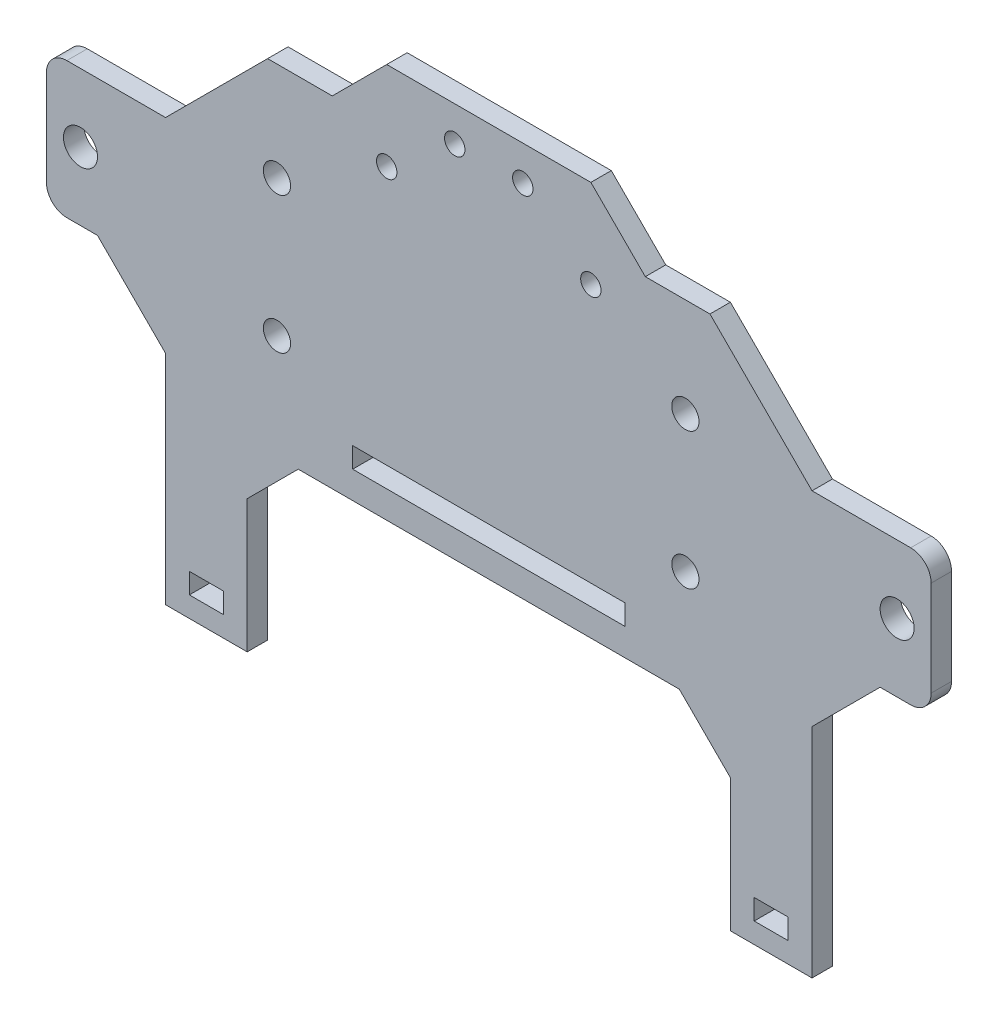
from build123d import *

# Parameters (mm, degrees)
SKETCH1_R           = 1.5
SKETCH1_R_2         = 2.5
BOSS_EXTRUDE1_DEPTH = 3
CUT_EXTRUDE1_DEPTH  = 3
FILLET1_R           = 3
CHAMFER4_SIZE       = 15
CHAMFER5_SIZE       = 10
SKETCH13_W          = 30
SKETCH13_H          = 8
BOSS_EXTRUDE5_DEPTH = 3
SKETCH8_W           = 95
SKETCH8_H           = 65.304735008
CUT_EXTRUDE5_DEPTH  = 10
SKETCH11_W          = 95
SKETCH11_H          = 7
BOSS_EXTRUDE3_DEPTH = 3
SKETCH10_R          = 1.5
CUT_EXTRUDE6_DEPTH  = 3
BOSS_EXTRUDE4_DEPTH = 3
CHAMFER6_SIZE       = 8
SKETCH17_R          = 2
CUT_EXTRUDE9_DEPTH  = 10
SKETCH15_W          = 40
SKETCH15_H          = 3
CUT_EXTRUDE8_DEPTH  = 10
BOSS_EXTRUDE6_START = -3
BOSS_EXTRUDE6_DEPTH = 3
SKETCH18_W          = 5
SKETCH18_H          = 3
CUT_EXTRUDE11_DEPTH = 10


with BuildPart() as part:
    # Sketch1 → Boss-Extrude1 (new body)
    with BuildSketch(Plane.XY):
        with BuildLine():
            Line((40.5, -40), (44.5, -40))
            Line((44.5, -40), (47.5, -37))
            Line((47.5, -37), (47.5, 10))
            Line((47.5, 10), (47.5, 15))
            Line((47.5, 15), (52.5, 15))
            Line((52.5, 15), (70, 15))
            ThreePointArc((70, 15), (73.535533906, 16.464466094), (75, 20))
            Line((75, 20), (75, 60))
            ThreePointArc((75, 60), (73.535533906, 63.535533906), (70, 65))
            Line((70, 65), (-70, 65))
            ThreePointArc((-70, 65), (-73.535533906, 63.535533906), (-75, 60))
            Line((-75, 60), (-75, 20))
            ThreePointArc((-75, 20), (-73.535533906, 16.464466094), (-70, 15))
            Line((-70, 15), (-52.5, 15))
            Line((-52.5, 15), (-47.5, 15))
            Line((-47.5, 15), (-47.5, 10))
            Line((-47.5, 10), (-47.5, -37))
            Line((-47.5, -37), (-44.5, -40))
            Line((-44.5, -40), (-40.5, -40))
            Line((-40.5, -40), (-37.5, -37))
            Line((-37.5, -37), (-37.5, 10))
            ThreePointArc((-37.5, 10), (-36.035533906, 13.535533906), (-32.5, 15))
            Line((-32.5, 15), (32.5, 15))
            ThreePointArc((32.5, 15), (36.035533906, 13.535533906), (37.5, 10))
            Line((37.5, 10), (37.5, -37))
            Line((37.5, -37), (40.5, -40))
        make_face()
        with Locations((-42.5, -20)):
            Circle(SKETCH1_R, mode=Mode.SUBTRACT)
        with Locations((-42.5, -35)):
            Circle(SKETCH1_R, mode=Mode.SUBTRACT)
        with Locations((42.5, -20)):
            Circle(SKETCH1_R, mode=Mode.SUBTRACT)
        with Locations((42.5, -35)):
            Circle(SKETCH1_R, mode=Mode.SUBTRACT)
        with Locations((60, 40)):
            Circle(SKETCH1_R_2, mode=Mode.SUBTRACT)
        with Locations((15, 60)):
            Circle(SKETCH1_R, mode=Mode.SUBTRACT)
        with Locations(Location((-15, 60, 0), (0, 0, 180))):
            Circle(SKETCH1_R, mode=Mode.SUBTRACT)
        with Locations(Location((-60, 40, 0), (0, 0, 180))):
            Circle(SKETCH1_R_2, mode=Mode.SUBTRACT)
    extrude(amount=BOSS_EXTRUDE1_DEPTH)

    # Sketch3 → Cut-Extrude1 (cut)
    with BuildSketch(Plane.XY.offset(3)):
        Polygon((65, 50), (65, 30), (47.5, 30), (47.5, 15), (75, 15), (75, 23.034767996), (75, 32.364095159), (75, 65), (47.5, 65), (47.5, 50), align=None)
        Polygon((-47.5, 65), (-75, 65), (-75, 32.364095159), (-75, 23.034767996), (-75, 15), (-47.5, 15), (-47.5, 30), (-65, 30), (-65, 50), (-47.5, 50), align=None)
    extrude(amount=-CUT_EXTRUDE1_DEPTH, mode=Mode.SUBTRACT)

    # Fillet1
    fillet1_edges = [part.edges().sort_by_distance(p)[0] for p in [
        (65, 50, 1.5),
        (65, 30, 1.5),
        (-65, 50, 1.5),
        (-65, 30, 1.5),
    ]]
    fillet(fillet1_edges, radius=FILLET1_R)

    # Chamfer4
    chamfer4_edges = [part.edges().sort_by_distance(p)[0] for p in [
        (47.5, 65, 1.5),
        (-47.5, 65, 1.5),
    ]]
    chamfer(chamfer4_edges, length=CHAMFER4_SIZE - 0.0001)  # a hair under: the kernel refuses the full size

    # Chamfer5
    chamfer5_edges = [part.edges().sort_by_distance(p)[0] for p in [
        (47.5, 30, 1.5),
        (-47.5, 30, 1.5),
    ]]
    chamfer(chamfer5_edges, length=CHAMFER5_SIZE)

    # Sketch13 → Boss-Extrude5 (add)
    with BuildSketch(Plane.XY.offset(3)):
        with Locations((0, 69)):
            Rectangle(SKETCH13_W, SKETCH13_H)
    extrude(amount=-BOSS_EXTRUDE5_DEPTH)

    # Sketch8 → Cut-Extrude5 (cut)
    with BuildSketch(Plane.XY.offset(3)):
        with Locations((0, -12.652367504)):
            Rectangle(SKETCH8_W, SKETCH8_H)
    extrude(amount=-CUT_EXTRUDE5_DEPTH, mode=Mode.SUBTRACT)

    # Sketch11 → Boss-Extrude3 (add)
    with BuildSketch(Plane.XY.offset(3)):
        with Locations((0, 16.5)):
            Rectangle(SKETCH11_W, SKETCH11_H)
    extrude(amount=-BOSS_EXTRUDE3_DEPTH)

    # Sketch10 → Cut-Extrude6 (cut)
    with BuildSketch(Plane.XY.offset(3)):
        with Locations((5, 67.89)):
            Circle(SKETCH10_R)
        with Locations(Location((-5, 67.89, 0), (0, 0, 180))):
            Circle(SKETCH10_R)
        with Locations((-5, 18.11)):
            Circle(SKETCH10_R)
        with Locations(Location((5, 18.11, 0), (0, 0, 180))):
            Circle(SKETCH10_R)
        Polygon((-30, 13), (-28, 15), (28, 15), (30, 13), align=None)
    extrude(amount=-CUT_EXTRUDE6_DEPTH, mode=Mode.SUBTRACT)

    # Sketch12 → Boss-Extrude4 (add)
    with BuildSketch(Plane.XY.offset(3)):
        Polygon((47.5, 13), (47.5, -12), (35.5, -12), (35.5, 7.5), (30, 13), (35.5, 13), align=None)
        Polygon((-35.5, 13), (-47.5, 13), (-47.5, -12), (-35.5, -12), (-35.5, 7.5), (-30, 13), align=None)
    extrude(amount=-BOSS_EXTRUDE4_DEPTH)

    # Chamfer6
    chamfer6_edges = [part.edges().sort_by_distance(p)[0] for p in [
        (15, 65, 1.5),
        (-15, 65, 1.5),
    ]]
    chamfer(chamfer6_edges, length=CHAMFER6_SIZE - 0.0001)  # a hair under: the kernel refuses the full size

    # Sketch17 → Cut-Extrude9 (cut)
    with BuildSketch(Plane(origin=(0, 0, 0), x_dir=(-1, 0, 0), z_dir=(0, 0, -1))):
        with Locations((-28.88804467, 50.488766948)):
            Circle(SKETCH17_R)
        with Locations((-28.88804467, 30.407216077)):
            Circle(SKETCH17_R)
        with Locations((31.126767325, 30.407216077)):
            Circle(SKETCH17_R)
        with Locations((31.126767325, 50.488766948)):
            Circle(SKETCH17_R)
    extrude(amount=-CUT_EXTRUDE9_DEPTH, mode=Mode.SUBTRACT)

    # Sketch15 → Cut-Extrude8 (cut)
    with BuildSketch(Plane(origin=(0, 0, 0), x_dir=(-1, 0, 0), z_dir=(0, 0, -1))):
        with Locations((0, 20.5)):
            Rectangle(SKETCH15_W, SKETCH15_H)
    extrude(amount=-CUT_EXTRUDE8_DEPTH, mode=Mode.SUBTRACT)

    # Sketch16 → Boss-Extrude6 (add)
    with BuildSketch(Plane(origin=(0, 0, 0), x_dir=(-1, 0, 0), z_dir=(0, 0, -1)).offset(BOSS_EXTRUDE6_START)):
        with BuildLine():
            Line((3.792564702, 19), (6.207435298, 19))
            ThreePointArc((6.207435298, 19), (5, 16.61), (3.792564702, 19))
        make_face()
        with BuildLine():
            Line((-6.207435298, 19), (-3.792564702, 19))
            ThreePointArc((-3.792564702, 19), (-5, 16.61), (-6.207435298, 19))
        make_face()
    extrude(amount=BOSS_EXTRUDE6_DEPTH)

    # Sketch18 → Cut-Extrude11 (cut)
    with BuildSketch(Plane(origin=(0, 0, 0), x_dir=(-1, 0, 0), z_dir=(0, 0, -1))):
        with Locations((-131.776111861, 19.947341704)):
            Rectangle(SKETCH18_W, SKETCH18_H)
        with Locations((-41.5, -7.5)):
            Rectangle(SKETCH18_W, SKETCH18_H)
        with Locations((41.5, -7.5)):
            Rectangle(SKETCH18_W, SKETCH18_H)
    extrude(amount=-CUT_EXTRUDE11_DEPTH, mode=Mode.SUBTRACT)


solid = part.part
